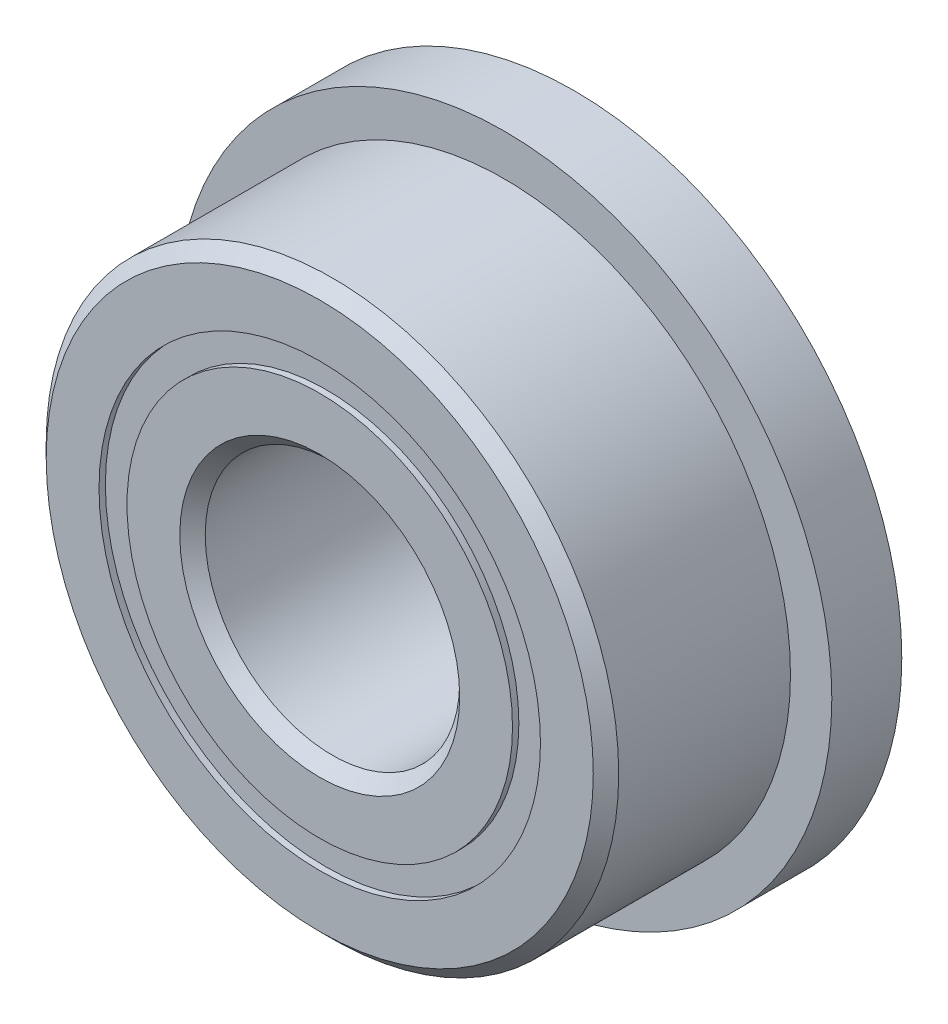
from build123d import *

# Parameters (mm, degrees)
CIRPATTERN1_COUNT = 12
SKETCH5_W         = 0.984343513
SKETCH5_H         = 0.43956044
SKETCH6_W         = 1.1
SKETCH6_H         = 1.68021978


with BuildPart() as part:
    # Sketch1 → Revolve1 (revolve)
    with BuildSketch(Plane(origin=(0, 0, 0), x_dir=(0, 0, -1), z_dir=(1, 0, 0))):
        with BuildLine():
            Line((1.8, 4.5), (-1.8, 4.5))
            Line((-1.8, 4.5), (-2, 4.3))
            Line((-2, 4.3), (-2, 3.46978022))
            Line((-2, 3.46978022), (-0.888888889, 3.46978022))
            ThreePointArc((-0.888888889, 3.46978022), (0, 4.165656487), (0.888888889, 3.46978022))
            Line((0.888888889, 3.46978022), (2, 3.46978022))
            Line((2, 3.46978022), (2, 4.3))
            Line((2, 4.3), (1.8, 4.5))
        make_face()
    revolve(axis=Axis((0, 0, 2), (0, 0, -1)))

    # Sketch6 → Revolve6 (revolve)
    with BuildSketch(Plane(origin=(0, 0, 0), x_dir=(0, 0, -1), z_dir=(1, 0, 0))):
        with Locations((1.45, 4.30989011)):
            Rectangle(SKETCH6_W, SKETCH6_H)
    revolve(axis=Axis((0, 0, -2), (0, 0, 1)))


with BuildPart() as body_2:
    # Sketch3 → Revolve3 (revolve)
    with BuildSketch(Plane(origin=(0, 0, 0), x_dir=(0, 0, -1), z_dir=(1, 0, 0))):
        with BuildLine():
            Line((-2, 3.03021978), (-0.888888889, 3.03021978))
            ThreePointArc((-0.888888889, 3.03021978), (0, 2.334343513), (0.888888889, 3.03021978))
            Line((0.888888889, 3.03021978), (2, 3.03021978))
            Line((2, 3.03021978), (2, 2.2))
            Line((2, 2.2), (1.8, 2))
            Line((1.8, 2), (-1.8, 2))
            Line((-1.8, 2), (-2, 2.2))
            Line((-2, 2.2), (-2, 3.03021978))
        make_face()
    revolve(axis=Axis((0, 0, 2), (0, 0, -1)))


with BuildPart() as body_3:
    # Sketch4 → Revolve4 (revolve)
    with BuildSketch(Plane(origin=(0, 0, 0), x_dir=(0, 0, -1), z_dir=(1, 0, 0))):
        with BuildLine():
            Line((-0.915656487, 3.25), (0.915656487, 3.25))
            ThreePointArc((0.915656487, 3.25), (0, 4.165656487), (-0.915656487, 3.25))
        make_face()
    revolve(axis=Axis((0, 3.25, 0.915656487), (0, 0, -1)))


with BuildPart() as cirpattern1_1:
    # CirPattern1: pattern copy
    add(body_3.part.rotate(Axis((0, 0, -2), (0, 0, 1)), 1 * 360 / CIRPATTERN1_COUNT))


with BuildPart() as cirpattern1_2:
    # CirPattern1: pattern copy
    add(body_3.part.rotate(Axis((0, 0, -2), (0, 0, 1)), 2 * 360 / CIRPATTERN1_COUNT))


with BuildPart() as cirpattern1_3:
    # CirPattern1: pattern copy
    add(body_3.part.rotate(Axis((0, 0, -2), (0, 0, 1)), 3 * 360 / CIRPATTERN1_COUNT))


with BuildPart() as cirpattern1_4:
    # CirPattern1: pattern copy
    add(body_3.part.rotate(Axis((0, 0, -2), (0, 0, 1)), 4 * 360 / CIRPATTERN1_COUNT))


with BuildPart() as cirpattern1_5:
    # CirPattern1: pattern copy
    add(body_3.part.rotate(Axis((0, 0, -2), (0, 0, 1)), 5 * 360 / CIRPATTERN1_COUNT))


with BuildPart() as cirpattern1_6:
    # CirPattern1: pattern copy
    add(body_3.part.rotate(Axis((0, 0, -2), (0, 0, 1)), 6 * 360 / CIRPATTERN1_COUNT))


with BuildPart() as cirpattern1_7:
    # CirPattern1: pattern copy
    add(body_3.part.rotate(Axis((0, 0, -2), (0, 0, 1)), 7 * 360 / CIRPATTERN1_COUNT))


with BuildPart() as cirpattern1_8:
    # CirPattern1: pattern copy
    add(body_3.part.rotate(Axis((0, 0, -2), (0, 0, 1)), 8 * 360 / CIRPATTERN1_COUNT))


with BuildPart() as cirpattern1_9:
    # CirPattern1: pattern copy
    add(body_3.part.rotate(Axis((0, 0, -2), (0, 0, 1)), 9 * 360 / CIRPATTERN1_COUNT))


with BuildPart() as cirpattern1_10:
    # CirPattern1: pattern copy
    add(body_3.part.rotate(Axis((0, 0, -2), (0, 0, 1)), 10 * 360 / CIRPATTERN1_COUNT))


with BuildPart() as cirpattern1_11:
    # CirPattern1: pattern copy
    add(body_3.part.rotate(Axis((0, 0, -2), (0, 0, 1)), 11 * 360 / CIRPATTERN1_COUNT))


with BuildPart() as body_15:
    # Sketch5 → Revolve5 (revolve)
    with BuildSketch(Plane(origin=(0, 0, 0), x_dir=(0, 0, -1), z_dir=(1, 0, 0))):
        with Locations((-1.407828244, 3.25)):
            Rectangle(SKETCH5_W, SKETCH5_H)
        with Locations((1.407828244, 3.25)):
            Rectangle(SKETCH5_W, SKETCH5_H)
    revolve(axis=Axis((0, 0, 2), (0, 0, -1)))


solid = Compound([part.part, body_2.part, body_3.part, cirpattern1_1.part, cirpattern1_2.part, cirpattern1_3.part, cirpattern1_4.part, cirpattern1_5.part, cirpattern1_6.part, cirpattern1_7.part, cirpattern1_8.part, cirpattern1_9.part, cirpattern1_10.part, cirpattern1_11.part, body_15.part])
